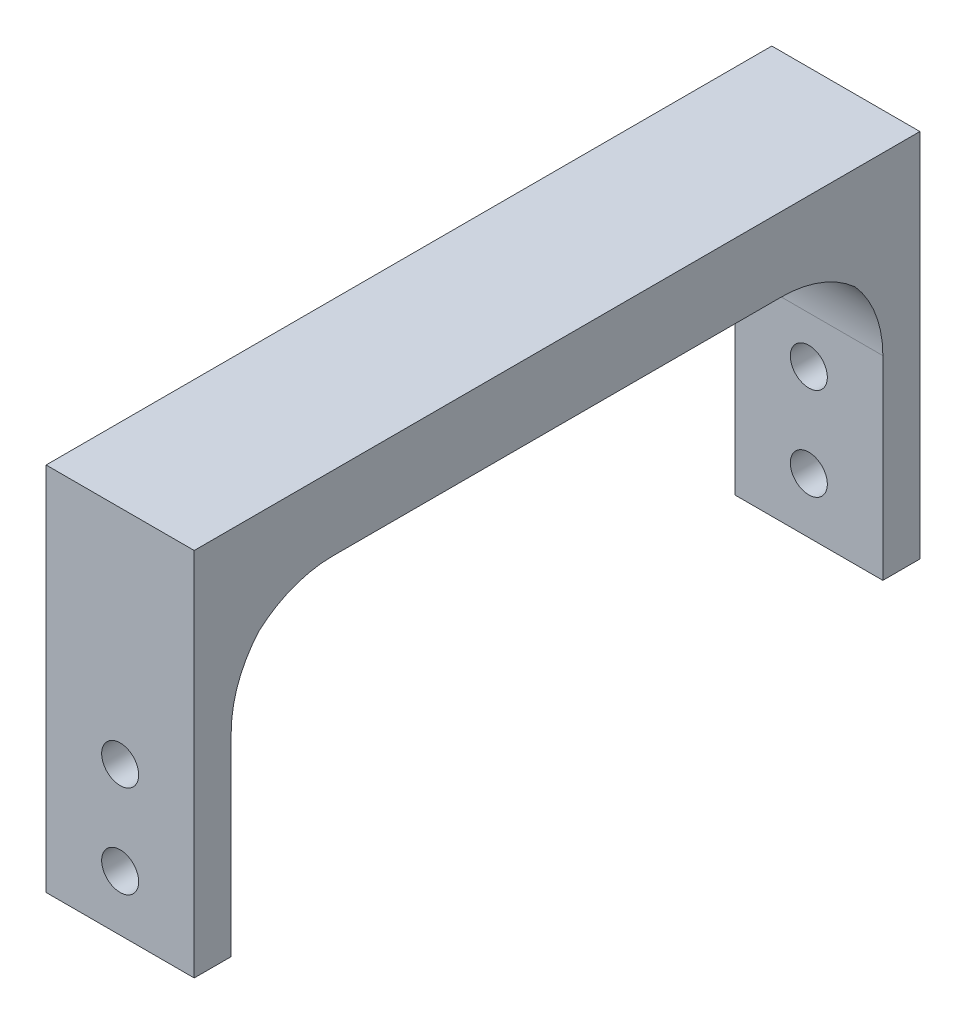
from build123d import *

# Parameters (mm, degrees)
SKETCH1_W           = 20
SKETCH1_H           = 50
BOSS_EXTRUDE1_DEPTH = 5
SKETCH3_R           = 2.5
CUT_EXTRUDE5_DEPTH  = 5
SKETCH4_W           = 20
SKETCH4_H           = 10
BOSS_EXTRUDE2_DEPTH = 88
SKETCH5_W           = 20
SKETCH5_H           = 50
BOSS_EXTRUDE3_DEPTH = 5
CUT_EXTRUDE6_START  = -5
SKETCH6_R           = 2.5
CUT_EXTRUDE6_DEPTH  = 5
BOSS_EXTRUDE4_DEPTH = 20
FILLET1_R           = 15
SHELL2_START        = 3.5
SHELL2_DEPTH        = 13


# Read off the part's stored shape, not the designer's step: Shell2
with BuildPart() as part:
    # Sketch1 → Boss-Extrude1 (new body)
    with BuildSketch(Plane.XY):
        with Locations((10, 25)):
            Rectangle(SKETCH1_W, SKETCH1_H)
    extrude(amount=BOSS_EXTRUDE1_DEPTH)

    # Sketch3 → Cut-Extrude5 (cut)
    with BuildSketch(Plane(origin=(0, 0, 0), x_dir=(-1, 0, 0), z_dir=(0, 0, -1))):
        with Locations((-10, 7.5)):
            Circle(SKETCH3_R)
        with Locations((-10, 20)):
            Circle(SKETCH3_R)
    extrude(amount=-CUT_EXTRUDE5_DEPTH, mode=Mode.SUBTRACT)

    # Sketch4 → Boss-Extrude2 (add)
    with BuildSketch(Plane.XY.offset(5)):
        with Locations((10, 45)):
            Rectangle(SKETCH4_W, SKETCH4_H)
    extrude(amount=BOSS_EXTRUDE2_DEPTH)

    # Sketch5 → Boss-Extrude3 (add)
    with BuildSketch(Plane.XY.offset(93)):
        with Locations((10, 25)):
            Rectangle(SKETCH5_W, SKETCH5_H)
    extrude(amount=BOSS_EXTRUDE3_DEPTH)

    # Sketch6 → Cut-Extrude6 (cut)
    with BuildSketch(Plane.XY.offset(98).offset(CUT_EXTRUDE6_START)):
        with Locations(Location((10, 7.5, 0), (0, 0, 180))):
            Circle(SKETCH6_R)
        with Locations(Location((10, 20, 0), (0, 0, 180))):
            Circle(SKETCH6_R)
    extrude(amount=CUT_EXTRUDE6_DEPTH, mode=Mode.SUBTRACT)

    # Sketch7 → Boss-Extrude4 (add)
    with BuildSketch(Plane(origin=(20, 0, 0), x_dir=(0, 0, -1), z_dir=(1, 0, 0))):
        Polygon((-93, 40), (-85.5, 40), (-93, 32.5), align=None)
        Polygon((-12.5, 40), (-5, 40), (-5, 32.5), align=None)
    extrude(amount=-BOSS_EXTRUDE4_DEPTH)

    # Fillet1
    # the kernel refuses this fillet: 15 mm, written as the material it adds along each edge
    with BuildSketch(Plane(origin=(20, 32.5, 5), x_dir=(0, -1, 0), z_dir=(-1, 0, 0)), Plane(origin=(20, 40, 85.5), x_dir=(0, 0, -1), z_dir=(-1, 0, 0))) as fillet1_piece_1:
        with BuildLine():
            CenterArc((FILLET1_R * 0.414213562373, FILLET1_R), FILLET1_R, 225, 45)
            Line((-FILLET1_R * 0.292893218813, FILLET1_R * 0.292893218813), (0, 0))
            Line((0, 0), (FILLET1_R * 0.414213562373, 0))
        make_face()
    extrude(amount=20)
    with BuildSketch(Plane(origin=(20, 40, 12.5), x_dir=(0, 0, 1), z_dir=(-1, 0, 0)), Plane(origin=(20, 32.5, 93), x_dir=(0, -1, 0), z_dir=(-1, 0, 0))) as fillet1_piece_2:
        with BuildLine():
            CenterArc((FILLET1_R * 0.414213562373, -FILLET1_R), FILLET1_R, 90, 45)
            Line((-FILLET1_R * 0.292893218813, -FILLET1_R * 0.292893218813), (0, 0))
            Line((0, 0), (FILLET1_R * 0.414213562373, 0))
        make_face()
    extrude(amount=20)

    # Shell2 outline → Shell2 (cut)
    with BuildSketch(Plane.YZ.offset(SHELL2_START)):
        with BuildLine():
            ThreePointArc((38.709041728, 91.709041728), (42.260754212, 85.943850268), (43.5, 79.286796564))
            Line((43.5, 79.286796564), (40, 79.286796564))
            Line((40, 79.286796564), (40, 18.713203436))
            Line((40, 18.713203436), (43.5, 18.713203436))
            ThreePointArc((43.5, 18.713203436), (42.260754212, 12.056149732), (38.709041728, 6.290958272))
            ThreePointArc((38.709041728, 6.290958272), (36.774474362, 4.759966719), (34.65339683, 3.5))
            Line((34.65339683, 3.5), (46.5, 3.5))
            Line((46.5, 3.5), (46.5, 94.5))
            Line((46.5, 94.5), (34.65339683, 94.5))
            ThreePointArc((34.65339683, 94.5), (36.774474362, 93.240033281), (38.709041728, 91.709041728))
        make_face()
    extrude(amount=SHELL2_DEPTH, mode=Mode.SUBTRACT)


solid = part.part
